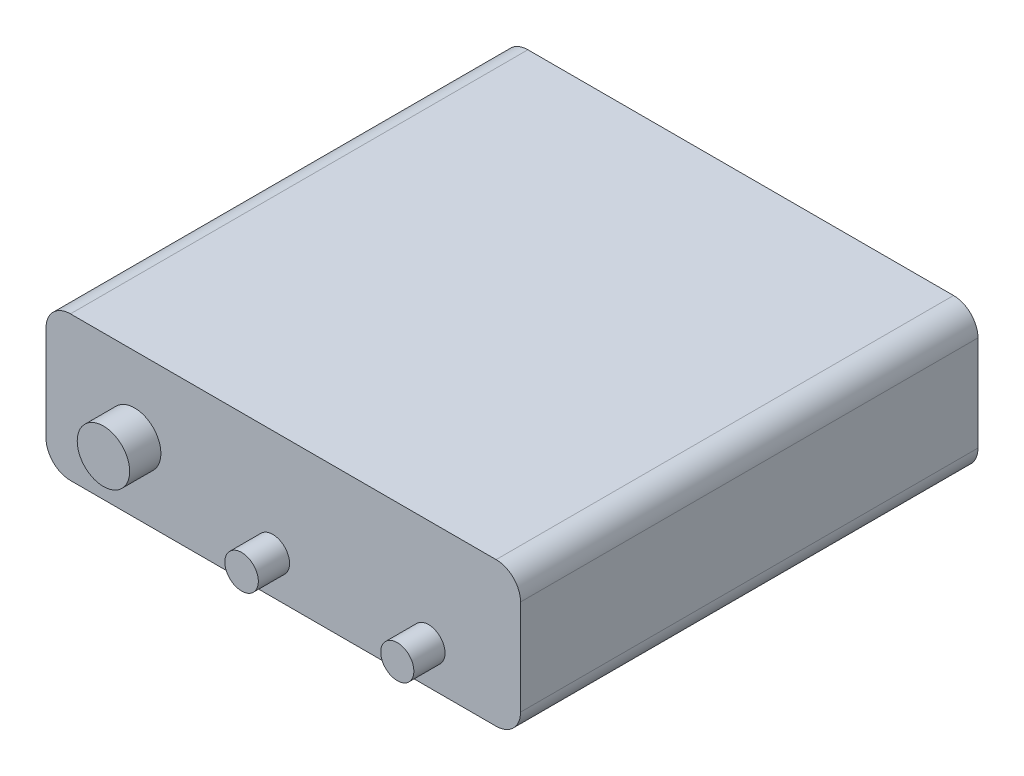
from build123d import *

# Parameters (mm, degrees)
SKETCH1_W           = 197.104
SKETCH1_H           = 189.992
BOSS_EXTRUDE1_DEPTH = 59.944
FILLET1_R           = 10.16
FILLET2_R           = 10.16
FILLET3_R           = 10.16
FILLET4_R           = 10.16
SKETCH2_R           = 10.892824913
SKETCH2_R_2         = 6.956698316
SKETCH2_R_3         = 6.871617304
BOSS_EXTRUDE3_DEPTH = 12.954


with BuildPart() as part:
    # Sketch1 → Boss-Extrude1 (new body)
    with BuildSketch(Plane(origin=(0, 0, 0), x_dir=(1, 0, 0), z_dir=(0, 1, 0))):
        with Locations((-98.552, -94.996)):
            Rectangle(SKETCH1_W, SKETCH1_H)
    extrude(amount=BOSS_EXTRUDE1_DEPTH)

    # Fillet1
    fillet1_edges = [part.edges().sort_by_distance(p)[0] for p in [
        (0, 59.944, 94.996),
    ]]
    fillet(fillet1_edges, radius=FILLET1_R)

    # Fillet2
    fillet2_edges = [part.edges().sort_by_distance(p)[0] for p in [
        (0, 0, 94.996),
    ]]
    fillet(fillet2_edges, radius=FILLET2_R)

    # Fillet3
    fillet3_edges = [part.edges().sort_by_distance(p)[0] for p in [
        (-197.104, 59.944, 94.996),
    ]]
    fillet(fillet3_edges, radius=FILLET3_R)

    # Fillet4
    fillet4_edges = [part.edges().sort_by_distance(p)[0] for p in [
        (-197.104, 0, 94.996),
    ]]
    fillet(fillet4_edges, radius=FILLET4_R)

    # Sketch2 → Boss-Extrude3 (add)
    with BuildSketch(Plane.XY.offset(189.992)):
        with Locations((-160.289066684, 28.528637542)):
            Circle(SKETCH2_R)
        with Locations((-102.910266874, 15.674726269)):
            Circle(SKETCH2_R_2)
        with Locations((-38.243166858, 15.674726269)):
            Circle(SKETCH2_R_3)
    extrude(amount=BOSS_EXTRUDE3_DEPTH)


solid = part.part
